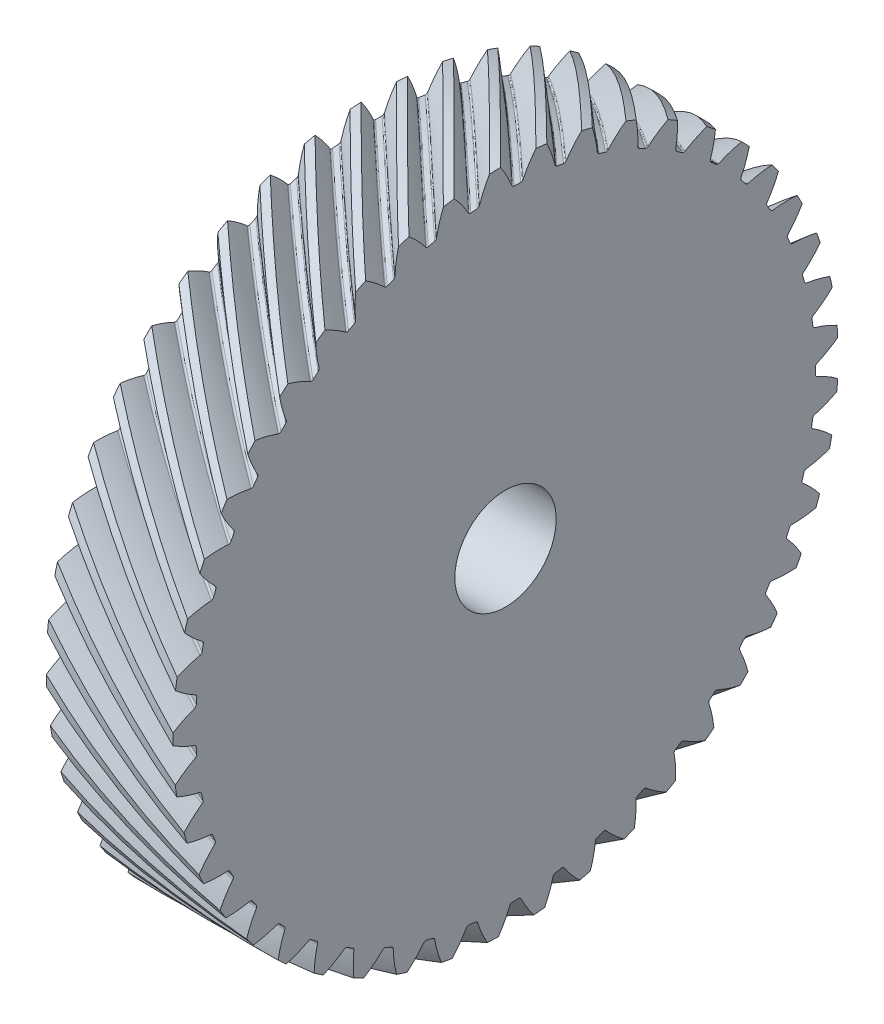
from build123d import *

# Parameters (mm, degrees)
BASPROSKE_W            = 5
BASPROSKE_H            = 13.127922061
TOOTHCUTRH_PITCH       = 82.48516701
TOOTHCUTRH_HEIGHT      = 5
TOOTHCUTRH_RADIUS      = 13.127922061
TOOTHCUTRH_START_ANGLE = -90
TEETHCUTSRH_COUNT      = 45
TEETHCUTSRH_ANGLE      = 352
BORSKE_R               = 2
BORE_DEPTH             = 62.5000025


with BuildPart() as part:
    # BasProSke → Base-Revolve (revolve)
    with BuildSketch(Plane(origin=(0, 0, 0), x_dir=(1, 0, 0), z_dir=(0, 1, 0)), mode=Mode.PRIVATE) as base_revolve_sk:
        with Locations((2.5, 6.563961031)):
            Rectangle(BASPROSKE_W, BASPROSKE_H)
    revolve(base_revolve_sk.sketch.rotate(Axis((-10, 0, 0), (1, 0, 0)), 180), axis=Axis((-10, 0, 0), (1, 0, 0)))

    # ToothCutRH: sweep along a helix
    with BuildLine() as toothcutrh_path:
        add(Helix(TOOTHCUTRH_PITCH, TOOTHCUTRH_HEIGHT, TOOTHCUTRH_RADIUS, center=(0, 0, 0), direction=(1, 0, 0), mode=Mode.PRIVATE).rotate(Axis((0, 0, 0), (1, 0, 0)), TOOTHCUTRH_START_ANGLE))
    # TooCutSkeRH → ToothCutRH (sweep, cut)
    with BuildSketch(Plane(origin=(0, 0, 0), x_dir=(0, 0, -1), z_dir=(1, 0, 0))):
        with BuildLine():
            ThreePointArc((0.128911623, 12.227242524), (0, 12.227922061), (-0.128911623, 12.227242524))
            ThreePointArc((-0.128911623, 12.227242524), (-0.18451575, 12.243228324), (-0.22222329, 12.287108913))
            ThreePointArc((-0.22222329, 12.287108913), (-0.56569975, 12.917035476), (-1.004926796, 13.484365322))
            ThreePointArc((-1.004926796, 13.484365322), (0, 13.521759723), (1.004926796, 13.484365322))
            ThreePointArc((1.004926796, 13.484365322), (0.56569975, 12.917035476), (0.22222329, 12.287108913))
            ThreePointArc((0.22222329, 12.287108913), (0.18451575, 12.243228324), (0.128911623, 12.227242524))
        make_face()
    toothcutrh = sweep(path=toothcutrh_path.line, is_frenet=True, mode=Mode.SUBTRACT)

    # TeethCutsRH: ToothCutRH ×45 about axis
    teethcutsrh_axis = Axis((-10, 0, 0), (1, 0, 0))
    for i in range(1, TEETHCUTSRH_COUNT):
        add(toothcutrh.rotate(teethcutsrh_axis, i * TEETHCUTSRH_ANGLE / (TEETHCUTSRH_COUNT - 1)), mode=Mode.SUBTRACT)

    # BorSke → Bore (cut, symmetric)
    with BuildSketch(Plane(origin=(0, 0, 0), x_dir=(0, 0, -1), z_dir=(1, 0, 0))):
        with Locations(Location((0, 0, 0), (0, 0, 180))):
            Circle(BORSKE_R)
    extrude(amount=BORE_DEPTH, both=True, mode=Mode.SUBTRACT)


solid = part.part
